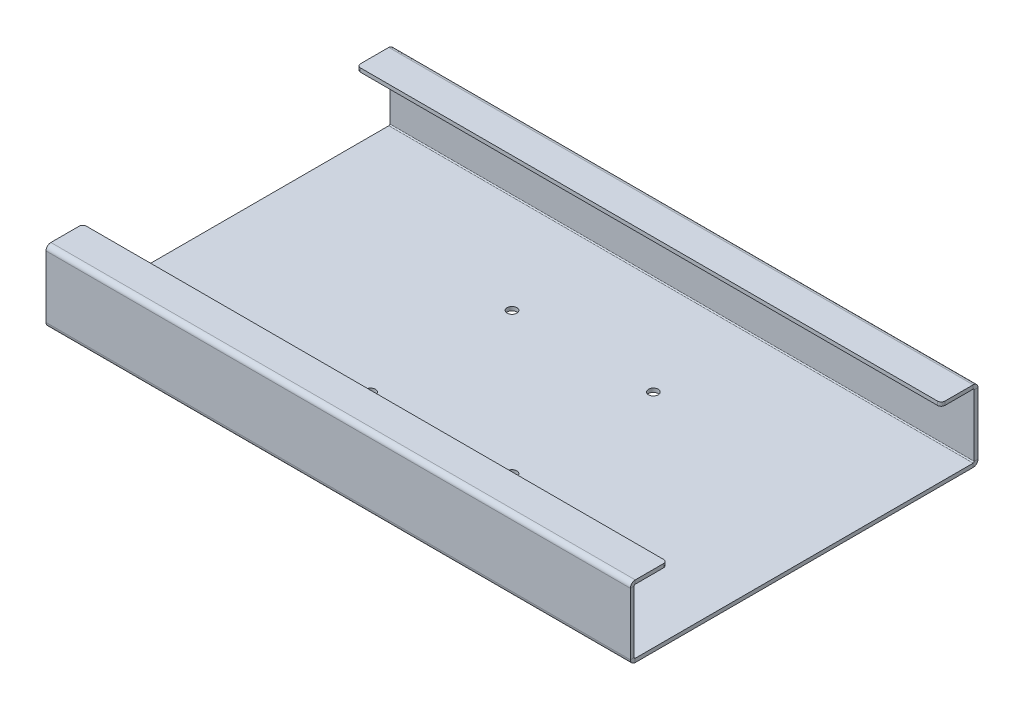
from build123d import *

# Parameters (mm, degrees)
SKETCH1_W               = 393.7
SKETCH1_H               = 229.108
BASE_FLANGE1_DEPTH      = 2.54
MITER_START             = -196.85
MITER_FLANGE1_DEPTH     = 393.7
MITER_FLANGE1_2_DEPTH   = 393.7
FILLET1_R               = 2.54
F_1_4_CLEARANCE_HOLE1_D = 6.5278


# Read off the part's stored shape, not the designer's step: Miter Flange1
# Sheet-metal steps are written as plain solids
with BuildPart() as part:
    # Sketch1 → Base-Flange1 (new body)
    with BuildSketch(Plane(origin=(0, 0, 0), x_dir=(1, 0, 0), z_dir=(0, 1, 0))):
        Rectangle(SKETCH1_W, SKETCH1_H)
    extrude(amount=-BASE_FLANGE1_DEPTH)

    # Miter Flange1 outline → Miter Flange1 (cut)
    with BuildSketch(Plane.YZ.offset(MITER_START)):
        with BuildLine():
            Line((-2.54, -114.554), (-2.456130493, -114.554))
            ThreePointArc((-2.456130493, -114.554), (-2.518965104, -114.188079664), (-2.54, -113.8174))
            Line((-2.54, -113.8174), (-2.54, -114.554))
        make_face()
    miter_flange1 = extrude(amount=MITER_FLANGE1_DEPTH, mode=Mode.SUBTRACT)

    # Miter Flange1 2 outline → Miter Flange1 2 (add)
    with BuildSketch(Plane.YZ.offset(MITER_START)):
        with BuildLine():
            Line((45.72, -113.8174), (45.72, -92.329))
            Line((45.72, -92.329), (43.18, -92.329))
            Line((43.18, -92.329), (43.18, -113.8174))
            ThreePointArc((43.18, -113.8174), (42.964254855, -114.338254855), (42.4434, -114.554))
            Line((42.4434, -114.554), (0.7366, -114.554))
            ThreePointArc((0.7366, -114.554), (0.215745145, -114.338254855), (0, -113.8174))
            Line((0, -113.8174), (0, -114.554))
            Line((0, -114.554), (-2.456130493, -114.554))
            ThreePointArc((-2.456130493, -114.554), (-1.303322057, -116.381542266), (0.7366, -117.094))
            Line((0.7366, -117.094), (42.4434, -117.094))
            ThreePointArc((42.4434, -117.094), (44.760306079, -116.134306079), (45.72, -113.8174))
        make_face()
    miter_flange1_2 = extrude(amount=MITER_FLANGE1_2_DEPTH)

    # Mirror1: Miter Flange1, Miter Flange1 2 across plane
    add(miter_flange1.mirror(Plane.XY), mode=Mode.SUBTRACT)
    add(miter_flange1_2.mirror(Plane.XY))

    # Fillet1
    fillet1_edges = [part.edges().sort_by_distance(p)[0] for p in [
        (-196.85, 44.45, -92.329),
        (196.85, 44.45, -92.329),
        (-196.85, 44.45, 92.329),
        (196.85, 44.45, 92.329),
    ]]
    fillet(fillet1_edges, radius=FILLET1_R)

    # 1/4 Clearance Hole1 (through all)
    with Locations(Plane(origin=(0, -2.54, 0), x_dir=(-1, 0, 0), z_dir=(0, -1, 0))):
        with Locations((-47.625, -47.625), (-47.625, 47.625), (47.625, 47.625), (47.625, -47.625)):
            Hole(F_1_4_CLEARANCE_HOLE1_D / 2)


solid = part.part
